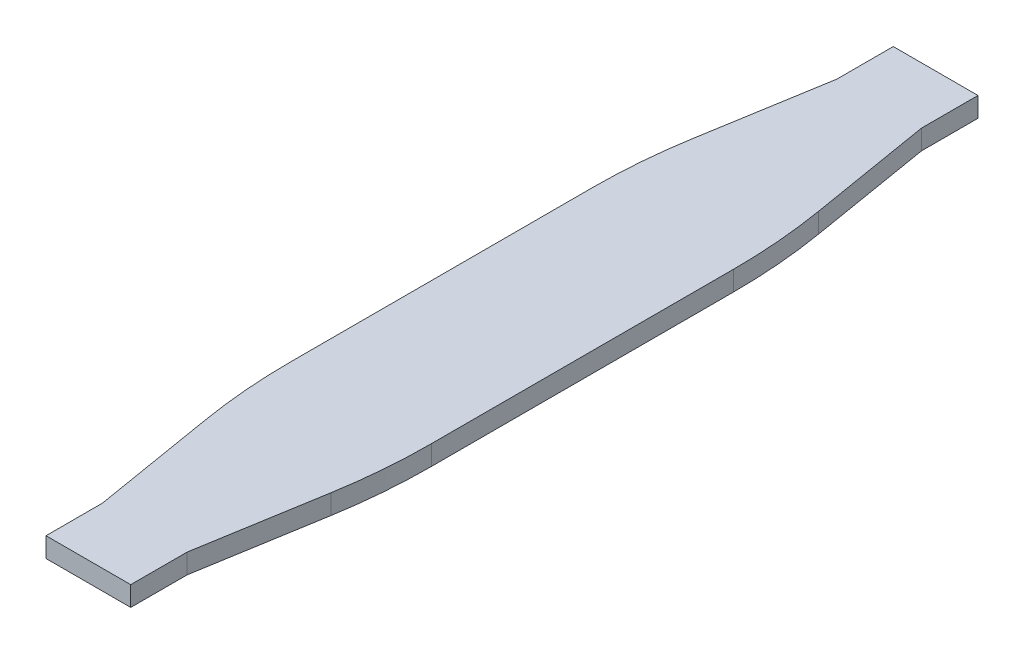
from build123d import *

# Parameters (mm, degrees)
BOSS_EXTRUDE1_DEPTH = 0.35
FILLET1_R           = 10


with BuildPart() as part:
    # Sketch1 → Boss-Extrude1 (new body)
    with BuildSketch(Plane(origin=(0, 0, 0.002129552), x_dir=(1, 0, 0), z_dir=(0, 1, 0))):
        Polygon((65.957189, 129.495721477), (66.457189, 132.495721477), (66.457189, 139.495721477), (65.957189, 142.495721477), (65.957189, 143.495721477), (64.457189, 143.495721477), (64.457189, 142.495721477), (63.957189, 139.495721477), (63.957189, 132.495721477), (64.457189, 129.495721477), (64.457189, 128.495721477), (65.207189, 128.495721477), (65.957189, 128.495721477), align=None)
    extrude(amount=BOSS_EXTRUDE1_DEPTH)

    # Fillet1
    fillet1_edges = [part.edges().sort_by_distance(p)[0] for p in [
        (66.457189, 0.175, -139.493591924),
        (66.457189, 0.175, -132.493591924),
        (63.957189, 0.175, -132.493591924),
        (63.957189, 0.175, -139.493591924),
    ]]
    fillet(fillet1_edges, radius=FILLET1_R)


solid = part.part
